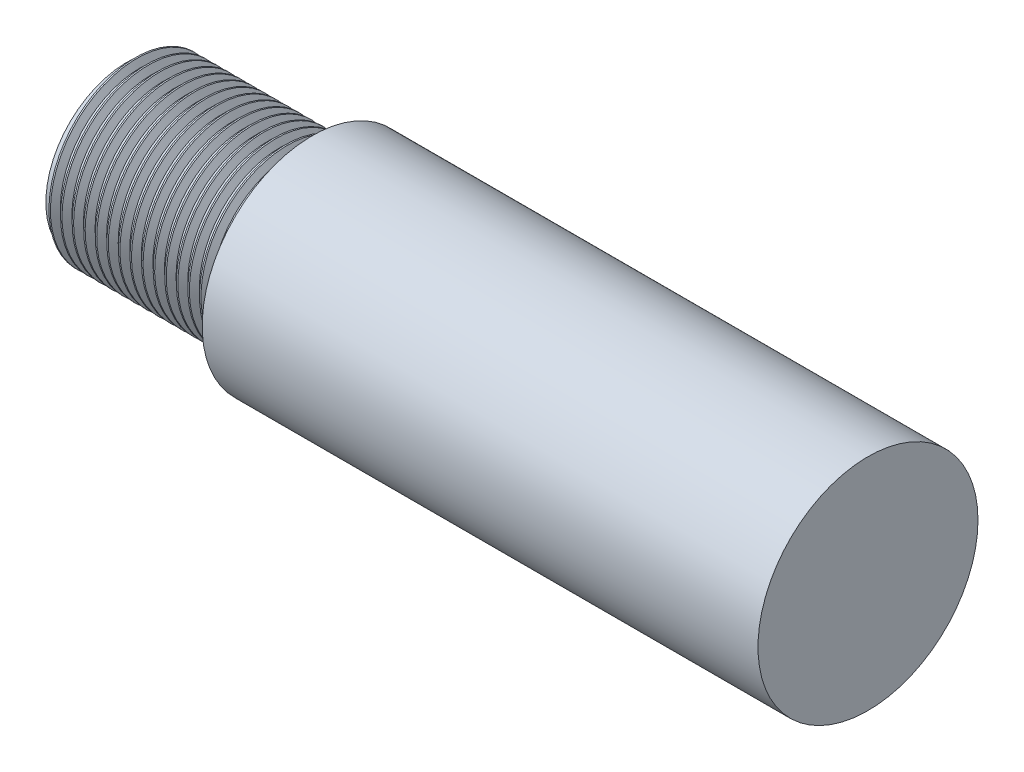
from build123d import *

# Parameters (mm, degrees)
SKETCH1_R           = 2.375
BOSS_EXTRUDE1_DEPTH = 12
SKETCH2_R           = 1.75
BOSS_EXTRUDE2_DEPTH = 4
THREAD1_PITCH       = 0.25


with BuildPart() as part:
    # Sketch1 → Boss-Extrude1 (new body)
    with BuildSketch(Plane(origin=(0, 0, 0), x_dir=(0, 0, -1), z_dir=(1, 0, 0))):
        Circle(SKETCH1_R)
    extrude(amount=BOSS_EXTRUDE1_DEPTH)

    # Sketch2 → Boss-Extrude2 (add)
    with BuildSketch(Plane.ZY):
        Circle(SKETCH2_R)
    extrude(amount=BOSS_EXTRUDE2_DEPTH)

    # Thread1: the profile of Thread Profile1 profile screwed along a right-hand helix of 16 turns, 6 arcs to a turn; built about Z, then put on its axis
    thread1_z = Axis((0, 0, 0), (0, 0, 1))
    thread1_corners = [(1.7497, 0, -0.000173205), (1.885316469, 0, 0.078125), (1.885316469, 0, 0.109375), (1.7497, 0, 0.187673204)]
    with BuildLine(mode=Mode.PRIVATE) as thread1_profile:
        Line(thread1_corners[0], thread1_corners[1])
        Line(thread1_corners[1], thread1_corners[2])
        Line(thread1_corners[2], thread1_corners[3])
        Line(thread1_corners[3], thread1_corners[0])
    thread1_cap = Face(thread1_profile.wire())
    thread1_turn_angles = [0, 30, 60, 90, 120, 150, 180, 210, 240, 270, 300, 330, 360]
    thread1_turn_weights = [1, 0.8660254037844387, 1, 0.8660254037844387, 1, 0.8660254037844387, 1, 0.8660254037844387, 1, 0.8660254037844387, 1, 0.8660254037844387, 1]
    thread1_turn_rails = [Edge.make_bspline([Vector(p[0], p[1], 0).rotate(thread1_z, thread1_turn_angles[k]) / thread1_turn_weights[k] + Vector(0, 0, p[2] + THREAD1_PITCH * thread1_turn_angles[k] / 360) for k in range(13)], [0, 0, 0, 1, 1, 2, 2, 3, 3, 4, 4, 5, 5, 6, 6, 6], 2, thread1_turn_weights) for p in thread1_corners]
    thread1_turn_sides = [Face.make_surface_from_curves(thread1_turn_rails[p[0]], thread1_turn_rails[p[1]]) for p in [(0, 1), (1, 2), (2, 3), (3, 0)]]
    thread1 = Plane(origin=(-4, 0, 0), x_dir=(0, 0, -1), z_dir=(1, 0, 0)) * Solid(Shell([*[p.moved(Location((0, 0, THREAD1_PITCH * i))) for i in range(16) for p in thread1_turn_sides], thread1_cap, thread1_cap.rotate(thread1_z, 5760).moved(Location((0, 0, THREAD1_PITCH * 5760 / 360)))]))
    add(thread1)


solid = part.part
